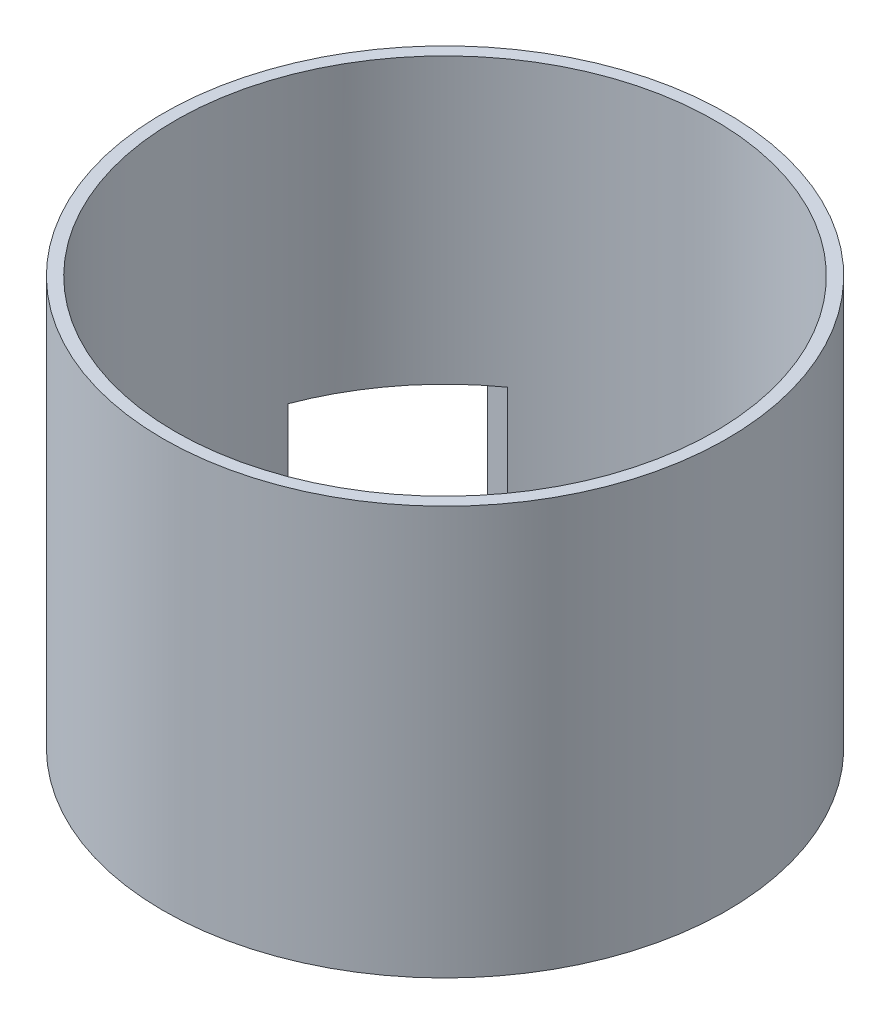
from build123d import *

# Parameters (mm, degrees)
SKETCH1_R           = 69
SKETCH1_R_2         = 66
BOSS_EXTRUDE1_DEPTH = 100
CUT_EXTRUDE1_REACH  = 200.205
SKETCH3_W           = 20
SKETCH3_H           = 28
FILLET1_R           = 3
SKETCH4_W           = 30.4
SKETCH4_H           = 30.4
CUT_EXTRUDE2_DEPTH  = 140.721151039


with BuildPart() as part:
    # Sketch1 → Boss-Extrude1 (new body)
    with BuildSketch(Plane(origin=(0, 0, 0), x_dir=(1, 0, 0), z_dir=(0, 1, 0))):
        Circle(SKETCH1_R)
        Circle(SKETCH1_R_2, mode=Mode.SUBTRACT)
    extrude(amount=BOSS_EXTRUDE1_DEPTH)

    # Sketch3 → Cut-Extrude1 (cut, up to next)
    with BuildSketch(Plane(origin=(-64.951905284, 0, 37.5), x_dir=(-0.5000000000000013, 0, -0.8660254037844379), z_dir=(0.8660254037844378, 0, -0.5000000000000012)), mode=Mode.PRIVATE) as cut_extrude1_sk1:
        with Locations((0, 45.5)):
            Rectangle(SKETCH3_W, SKETCH3_H)
    cut_extrude1_tool1 = extrude(cut_extrude1_sk1.sketch, amount=CUT_EXTRUDE1_REACH, mode=Mode.PRIVATE) & part.part
    add(cut_extrude1_tool1.solids().sort_by_distance((-64.951905, 45.5, 37.5))[0], mode=Mode.SUBTRACT)

    # Fillet1
    fillet1_edges = [part.edges().sort_by_distance(p)[0] for p in [
        (-52.811327716, 31.5, 42.037639657),
        (-62.811327716, 31.5, 24.717131581),
        (-52.811327716, 59.5, 42.037639657),
        (-62.811327716, 59.5, 24.717131581),
    ]]
    fillet(fillet1_edges, radius=FILLET1_R)

    # Sketch4 → Cut-Extrude2 (cut, through all)
    with BuildSketch(Plane(origin=(0, 0, 0), x_dir=(0, 0, -1), z_dir=(1, 0, 0))):
        with Locations((38.5, 15.2)):
            Rectangle(SKETCH4_W, SKETCH4_H)
    extrude(amount=-CUT_EXTRUDE2_DEPTH, mode=Mode.SUBTRACT)


solid = part.part
